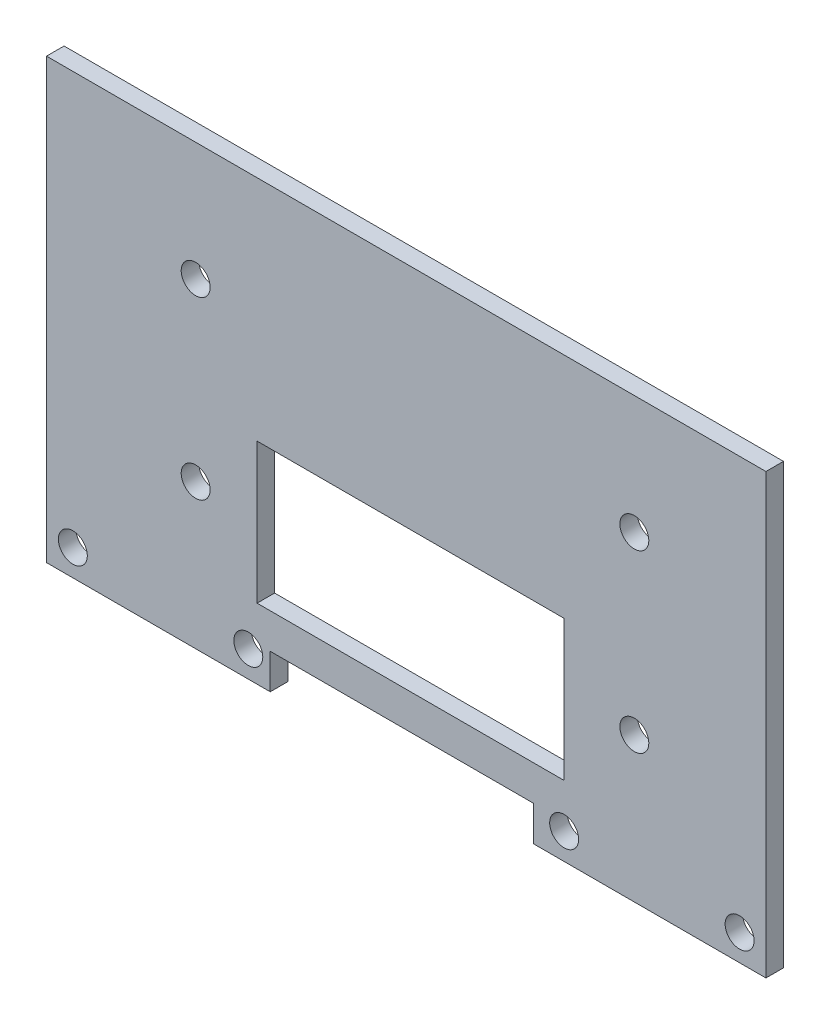
from build123d import *

# Parameters (mm, degrees)
SKETCH_1_W          = 80
SKETCH_1_H          = 50
EXTRUDE_1_DEPTH     = 2
SKETCH_5_W          = 2
SKETCH_5_H          = 50
EXTRUDE_2_DEPTH     = 2
SKETCH_2_W          = 30
SKETCH_2_H          = 4
SKETCH_2_W_2        = 35
SKETCH_2_H_2        = 16
CUT_EXTRUDE_1_DEPTH = 49.918299235
SKETCH_3_R          = 1.65
CUT_EXTRUDE_2_DEPTH = 49.918299235
SKETCH_6_W          = 1.5
SKETCH_6_H          = 4
CUT_EXTRUDE_4_DEPTH = 49.918299235
SKETCH_7_W          = 1.5
SKETCH_7_H          = 4
EXTRUDE_3_DEPTH     = 2
SKETCH_8_R          = 1.65
CUT_EXTRUDE_5_DEPTH = 49.918299235


with BuildPart() as part:
    # 草图1 → 凸台-拉伸1 (new body)
    with BuildSketch(Plane.XY):
        Rectangle(SKETCH_1_W, SKETCH_1_H)
    extrude(amount=EXTRUDE_1_DEPTH)

    # 草图5 → 凸台-拉伸2 (add)
    with BuildSketch(Plane.XY.offset(2)):
        with Locations((-41, 0)):
            Rectangle(SKETCH_5_W, SKETCH_5_H)
    extrude(amount=-EXTRUDE_2_DEPTH)

    # 草图2 → 切除-拉伸1 (cut, through all)
    with BuildSketch(Plane.XY.offset(2)):
        with Locations((0, -23)):
            Rectangle(SKETCH_2_W, SKETCH_2_H)
        with Locations((-0.5, -9)):
            Rectangle(SKETCH_2_W_2, SKETCH_2_H_2)
    extrude(amount=-CUT_EXTRUDE_1_DEPTH, mode=Mode.SUBTRACT)

    # 草图3 → 切除-拉伸2 (cut, through all)
    with BuildSketch(Plane.XY.offset(2)):
        with Locations((-39, -22)):
            Circle(SKETCH_3_R)
        with Locations((-19, -22)):
            Circle(SKETCH_3_R)
        with Locations((17, -22)):
            Circle(SKETCH_3_R)
        with Locations((37, -22)):
            Circle(SKETCH_3_R)
    extrude(amount=-CUT_EXTRUDE_2_DEPTH, mode=Mode.SUBTRACT)

    # 草图6 → 切除-拉伸4 (cut, through all)
    with BuildSketch(Plane.XY.offset(2)):
        with Locations((-15.75, -23)):
            Rectangle(SKETCH_6_W, SKETCH_6_H)
    extrude(amount=-CUT_EXTRUDE_4_DEPTH, mode=Mode.SUBTRACT)

    # 草图7 → 凸台-拉伸3 (add)
    with BuildSketch(Plane.XY.offset(2)):
        with Locations((14.25, -23)):
            Rectangle(SKETCH_7_W, SKETCH_7_H)
    extrude(amount=-EXTRUDE_3_DEPTH)

    # 草图8 → 切除-拉伸5 (cut, through all)
    with BuildSketch(Plane.XY.offset(2)):
        with Locations((-25, 11.5)):
            Circle(SKETCH_8_R)
        with Locations((-25, -8.5)):
            Circle(SKETCH_8_R)
        with Locations((25, -8.5)):
            Circle(SKETCH_8_R)
        with Locations((25, 11.5)):
            Circle(SKETCH_8_R)
    extrude(amount=-CUT_EXTRUDE_5_DEPTH, mode=Mode.SUBTRACT)


solid = part.part
